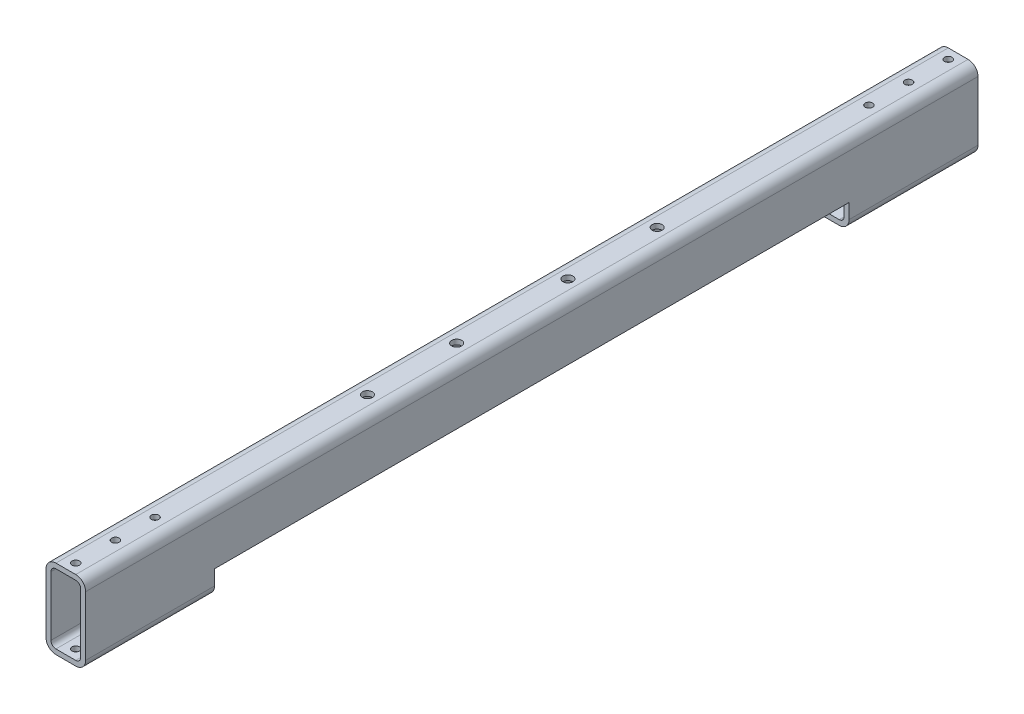
from build123d import *

# Parameters (mm, degrees)
EXTRUDE_THIN1_DEPTH            = 571.5
F_3_16_0_1875_DIAMETER_HOLE1_D = 4.7625
SKETCH5_W                      = 406.4
SKETCH5_H                      = 15.875
CUT_EXTRUDE1_DEPTH             = 573.627776134
F_1_4_0_25_DIAMETER_HOLE1_D    = 6.35
E_0_25_DIAMETER_HOLE1_D        = 6.35
E_0_25_DIAMETER_HOLE1_DEPTH    = 6.35
E_0_25_DIAMETER_HOLE1_TIP      = 1.907732465


with BuildPart() as part:
    # Sketch1 → Extrude-Thin1 (new body)
    with BuildSketch(Plane.XY):
        with BuildLine():
            Line((-12.7, 19.05), (-12.7, -19.05))
            ThreePointArc((-12.7, -19.05), (-10.840128061, -23.540128061), (-6.35, -25.4))
            Line((-6.35, -25.4), (6.35, -25.4))
            ThreePointArc((6.35, -25.4), (10.840128061, -23.540128061), (12.7, -19.05))
            Line((12.7, -19.05), (12.7, 19.05))
            ThreePointArc((12.7, 19.05), (10.840128061, 23.540128061), (6.35, 25.4))
            Line((6.35, 25.4), (-6.35, 25.4))
            ThreePointArc((-6.35, 25.4), (-10.840128061, 23.540128061), (-12.7, 19.05))
        make_face()
        with BuildLine():
            Line((-9.525, 19.05), (-9.525, -19.05))
            ThreePointArc((-9.525, -19.05), (-8.59506403, -21.29506403), (-6.35, -22.225))
            Line((-6.35, -22.225), (6.35, -22.225))
            ThreePointArc((6.35, -22.225), (8.59506403, -21.29506403), (9.525, -19.05))
            Line((9.525, -19.05), (9.525, 19.05))
            ThreePointArc((9.525, 19.05), (8.59506403, 21.29506403), (6.35, 22.225))
            Line((6.35, 22.225), (-6.35, 22.225))
            ThreePointArc((-6.35, 22.225), (-8.59506403, 21.29506403), (-9.525, 19.05))
        make_face(mode=Mode.SUBTRACT)
    extrude(amount=EXTRUDE_THIN1_DEPTH)

    # 3/16 (0.1875) Diameter Hole1 (through all)
    with Locations(Plane(origin=(0, 25.4, 565.15), x_dir=(0, 0, 1), z_dir=(0, 1, 0))):
        with Locations((0, 0), (-558.8, 0), (-533.4, 0), (-508, 0), (-25.4, 0), (-50.8, 0)):
            Hole(F_3_16_0_1875_DIAMETER_HOLE1_D / 2)

    # Sketch5 → Cut-Extrude1 (cut, through all)
    with BuildSketch(Plane(origin=(12.7, 0, 0), x_dir=(0, 0, -1), z_dir=(1, 0, 0))):
        with Locations((-285.75, -17.4625)):
            Rectangle(SKETCH5_W, SKETCH5_H)
    extrude(amount=-CUT_EXTRUDE1_DEPTH, mode=Mode.SUBTRACT)

    # 1/4 (0.25) Diameter Hole1 (through all)
    with Locations(Plane(origin=(0, 25.4, 0), x_dir=(1, 0, 0), z_dir=(0, 1, 0))):
        with Locations((0, -321.183), (0, -378.333), (0, -192.786), (0, -249.936)):
            Hole(F_1_4_0_25_DIAMETER_HOLE1_D / 2)

    # E (0.25) Diameter Hole1
    with Locations(Plane.ZY.offset(12.7)):
        with Locations((103.886, 17.145), (103.886, 1.27), (116.586, 8.89), (454.914, 8.89), (467.614, 1.27), (467.614, 17.145)):
            Hole(E_0_25_DIAMETER_HOLE1_D / 2, depth=E_0_25_DIAMETER_HOLE1_DEPTH)
            with Locations((0, 0, -(E_0_25_DIAMETER_HOLE1_DEPTH + E_0_25_DIAMETER_HOLE1_TIP / 2))):  # 118° drill point
                Cone(0, E_0_25_DIAMETER_HOLE1_D / 2, E_0_25_DIAMETER_HOLE1_TIP, mode=Mode.SUBTRACT)


solid = part.part
